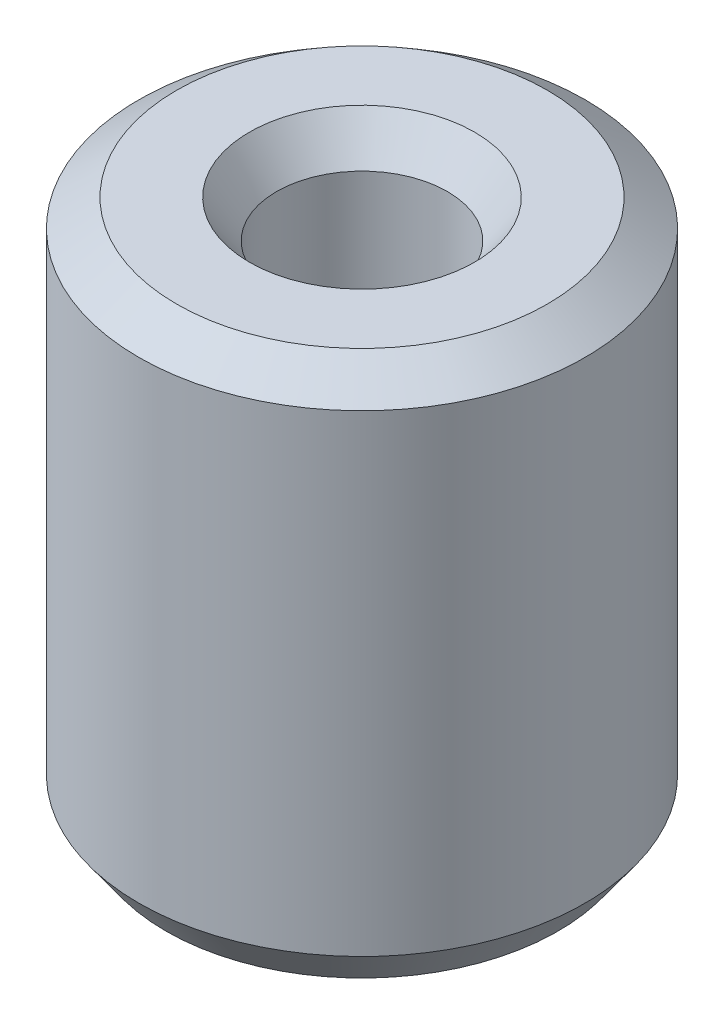
from build123d import *
from OCP.BRepFilletAPI import BRepFilletAPI_MakeChamfer

# Parameters (mm, degrees)
SKETCH1_R           = 32.5
BOSS_EXTRUDE1_DEPTH = 78.301453841
SKETCH2_R           = 12.448809354
CUT_EXTRUDE1_DEPTH  = 91.794370275
CHAMFER1_SIZE       = 3.957718819
CHAMFER1_SIZE2      = 5.515336958


with BuildPart() as part:
    # Sketch1 → Boss-Extrude1 (new body)
    with BuildSketch(Plane(origin=(0, 0, 0), x_dir=(1, 0, 0), z_dir=(0, 1, 0))):
        Circle(SKETCH1_R)
    extrude(amount=BOSS_EXTRUDE1_DEPTH)

    # Sketch2 → Cut-Extrude1 (cut, through all)
    with BuildSketch(Plane(origin=(0, 0, 0), x_dir=(1, 0, 0), z_dir=(0, 1, 0))):
        Circle(SKETCH2_R)
    extrude(amount=CUT_EXTRUDE1_DEPTH, mode=Mode.SUBTRACT)

    # Chamfer1: one chamfer whose edges measure the first distance from different faces: ONE call of the kernel's chamfer builder (chamfer() names one face for all edges)
    chamfer1_edges_1 = [part.edges().sort_by_distance(p)[0] for p in [
        (-12.448809354, 78.301453841, 0),
    ]]
    chamfer1_side_1 = [part.faces().sort_by_distance(p)[0] for p in [
        (-31.580761184, 78.301453841, 0),
    ]]
    chamfer1_edges_2 = [part.edges().sort_by_distance(p)[0] for p in [
        (-12.448809354, 0, 0),
    ]]
    chamfer1_side_2 = [part.faces().sort_by_distance(p)[0] for p in [
        (-12.448809354, 39.15072692, 0),
    ]]
    chamfer1_edges_3 = [part.edges().sort_by_distance(p)[0] for p in [
        (-32.5, 0, 0),
    ]]
    chamfer1_side_3 = [part.faces().sort_by_distance(p)[0] for p in [
        (-31.580761184, 0, 0),
    ]]
    chamfer1_edges_4 = [part.edges().sort_by_distance(p)[0] for p in [
        (-32.5, 78.301453841, 0),
    ]]
    chamfer1_side_4 = [part.faces().sort_by_distance(p)[0] for p in [
        (-32.5, 39.15072692, 0),
    ]]
    chamfer1 = BRepFilletAPI_MakeChamfer(part.part.solid().wrapped)
    for e in chamfer1_edges_1:
        chamfer1.Add(CHAMFER1_SIZE, CHAMFER1_SIZE2, e.wrapped, chamfer1_side_1[0].wrapped)  # the first distance lies on this face
    for e in chamfer1_edges_2:
        chamfer1.Add(CHAMFER1_SIZE, CHAMFER1_SIZE2, e.wrapped, chamfer1_side_2[0].wrapped)  # the first distance lies on this face
    for e in chamfer1_edges_3:
        chamfer1.Add(CHAMFER1_SIZE, CHAMFER1_SIZE2, e.wrapped, chamfer1_side_3[0].wrapped)  # the first distance lies on this face
    for e in chamfer1_edges_4:
        chamfer1.Add(CHAMFER1_SIZE, CHAMFER1_SIZE2, e.wrapped, chamfer1_side_4[0].wrapped)  # the first distance lies on this face
    add(Compound.cast(chamfer1.Shape()), mode=Mode.REPLACE)


solid = part.part
